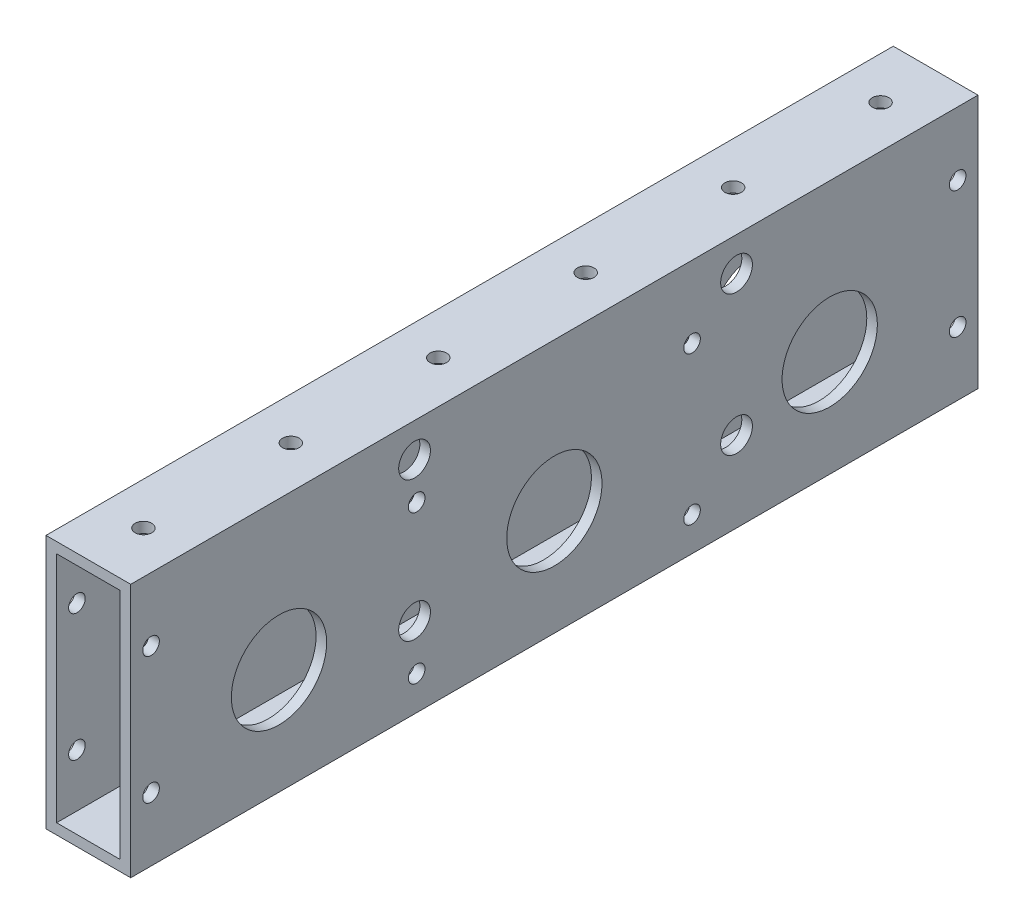
from build123d import *

# Parameters (mm, degrees)
SKETCH1_W                        = 254
SKETCH1_H                        = 76.2
BOSS_EXTRUDE1_DEPTH              = 25.4
SHELL1_T                         = -3.175
SKETCH2_R                        = 14.2875
CUT_EXTRUDE1_DEPTH               = 136.002851822
F_10_CLEARANCE_HOLE1_D           = 4.9784
F_10_CLEARANCE_HOLE2_D           = 4.9784
F_3_8_0_375_DIAMETER_HOLE1_D     = 9.525
F_3_8_0_375_DIAMETER_HOLE1_DEPTH = 12.7
F_3_8_0_375_DIAMETER_HOLE1_TIP   = 2.861598698
F_3_8_0_375_DIAMETER_HOLE2_D     = 9.525
F_3_8_0_375_DIAMETER_HOLE2_DEPTH = 12.7
F_3_8_0_375_DIAMETER_HOLE2_TIP   = 2.861598698
F_10_CLEARANCE_HOLE3_D           = 4.9784
F_10_CLEARANCE_HOLE3_DEPTH       = 12.7
F_10_CLEARANCE_HOLE3_TIP         = 1.495662253
F_10_CLEARANCE_HOLE4_D           = 4.9784
F_10_CLEARANCE_HOLE5_D           = 4.9784


with BuildPart() as part:
    # Sketch1 → Boss-Extrude1 (new body)
    with BuildSketch(Plane(origin=(0, 0, 0), x_dir=(0, 0, -1), z_dir=(1, 0, 0))):
        Rectangle(SKETCH1_W, SKETCH1_H)
    extrude(amount=BOSS_EXTRUDE1_DEPTH)

    # Shell1
    shell1_openings = [part.faces().sort_by_distance(p)[0] for p in [
        (12.7, 0, -127),
        (12.7, 0, 127),
    ]]
    offset(amount=SHELL1_T, openings=shell1_openings, kind=Kind.INTERSECTION)

    # Sketch2 → Cut-Extrude1 (cut, through all)
    with BuildSketch(Plane(origin=(25.4, 0, 0), x_dir=(0, 0, -1), z_dir=(1, 0, 0))):
        with Locations((0, -6.35)):
            Circle(SKETCH2_R)
        with Locations((-82.55, -6.35)):
            Circle(SKETCH2_R)
        with Locations((82.55, -6.35)):
            Circle(SKETCH2_R)
    extrude(amount=-CUT_EXTRUDE1_DEPTH, mode=Mode.SUBTRACT)

    # #10 Clearance Hole1 (through all)
    with Locations(Plane(origin=(25.4, 0, 0), x_dir=(0, 0, -1), z_dir=(1, 0, 0))):
        with Locations((-120.904, 19.05), (-120.904, -19.05)):
            f_10_clearance_hole1 = Hole(F_10_CLEARANCE_HOLE1_D / 2)

    # Mirror1: #10 Clearance Hole1 across plane
    add(f_10_clearance_hole1.mirror(Plane.XY), mode=Mode.SUBTRACT)

    # #10 Clearance Hole2 (through all)
    with Locations(Plane(origin=(25.4, 0, 0), x_dir=(0, 0, -1), z_dir=(1, 0, 0))):
        with Locations((-41.275, -27.94), (41.275, -27.94), (-41.275, 16.51), (41.275, 16.51)):
            Hole(F_10_CLEARANCE_HOLE2_D / 2)

    # 3/8 (0.375) Diameter Hole1
    with Locations(Plane.ZY):
        with Locations((-41.275, -27.94), (41.275, -27.94), (41.275, 16.51), (-41.275, 16.51)):
            Hole(F_3_8_0_375_DIAMETER_HOLE1_D / 2, depth=F_3_8_0_375_DIAMETER_HOLE1_DEPTH)
            with Locations((0, 0, -(F_3_8_0_375_DIAMETER_HOLE1_DEPTH + F_3_8_0_375_DIAMETER_HOLE1_TIP / 2))):  # 118° drill point
                Cone(0, F_3_8_0_375_DIAMETER_HOLE1_D / 2, F_3_8_0_375_DIAMETER_HOLE1_TIP, mode=Mode.SUBTRACT)

    # 3/8 (0.375) Diameter Hole2
    with Locations(Plane(origin=(25.4, 0, 0), x_dir=(0, 0, -1), z_dir=(1, 0, 0))):
        with Locations((-41.91, 27.94), (54.61, 27.94), (54.61, -13.97), (-41.91, -13.97)):
            Hole(F_3_8_0_375_DIAMETER_HOLE2_D / 2, depth=F_3_8_0_375_DIAMETER_HOLE2_DEPTH)
            with Locations((0, 0, -(F_3_8_0_375_DIAMETER_HOLE2_DEPTH + F_3_8_0_375_DIAMETER_HOLE2_TIP / 2))):  # 118° drill point
                Cone(0, F_3_8_0_375_DIAMETER_HOLE2_D / 2, F_3_8_0_375_DIAMETER_HOLE2_TIP, mode=Mode.SUBTRACT)

    # #10 Clearance Hole3
    with Locations(Plane.ZY):
        with Locations((41.91, 27.94), (-54.61, 27.94), (-54.61, -13.97), (41.91, -13.97)):
            Hole(F_10_CLEARANCE_HOLE3_D / 2, depth=F_10_CLEARANCE_HOLE3_DEPTH)
            with Locations((0, 0, -(F_10_CLEARANCE_HOLE3_DEPTH + F_10_CLEARANCE_HOLE3_TIP / 2))):  # 118° drill point
                Cone(0, F_10_CLEARANCE_HOLE3_D / 2, F_10_CLEARANCE_HOLE3_TIP, mode=Mode.SUBTRACT)

    # #10 Clearance Hole4 (through all)
    with Locations(Plane(origin=(0, -38.1, 0), x_dir=(-1, 0, 0), z_dir=(0, -1, 0))):
        with Locations((-12.7, -110.49), (-12.7, 110.49)):
            Hole(F_10_CLEARANCE_HOLE4_D / 2)

    # #10 Clearance Hole5 (through all)
    with Locations(Plane(origin=(0, 38.1, 0), x_dir=(1, 0, 0), z_dir=(0, 1, 0))):
        with Locations((12.7, 66.294), (12.7, 22.098)):
            f_10_clearance_hole5 = Hole(F_10_CLEARANCE_HOLE5_D / 2)

    # Mirror2: #10 Clearance Hole5 across plane
    add(f_10_clearance_hole5.mirror(Plane.XY), mode=Mode.SUBTRACT)


solid = part.part
